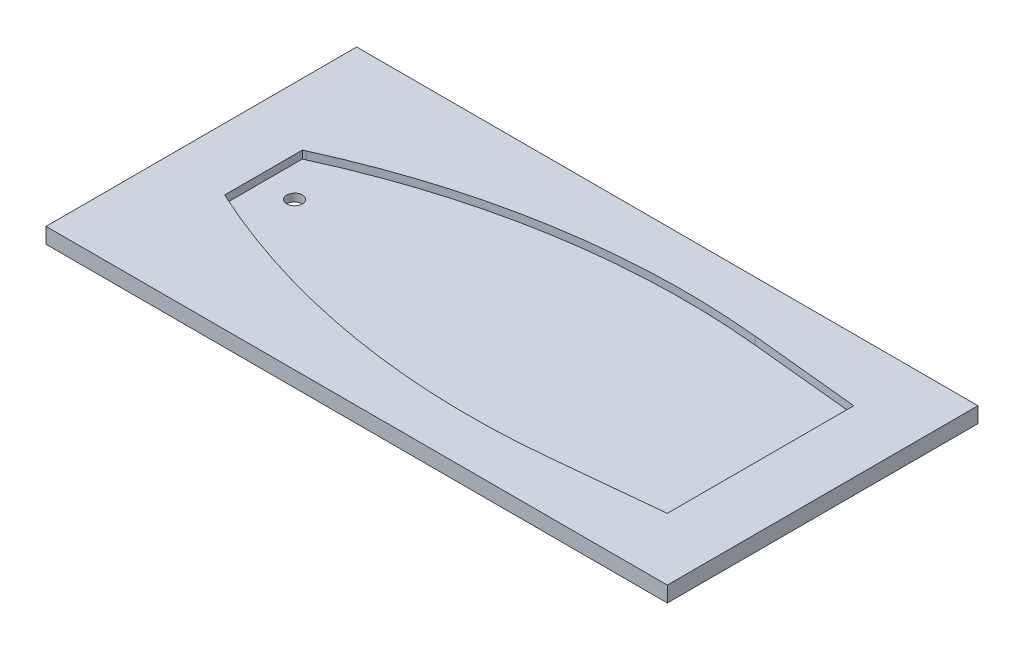
from build123d import *

# Parameters (mm, degrees)
SKETCH1_W           = 254
SKETCH1_H           = 127
BOSS_EXTRUDE1_DEPTH = 6.35
SKETCH2_R           = 3.175
CUT_EXTRUDE1_DEPTH  = 6.35
CUT_EXTRUDE3_DEPTH  = 3.175
FILLET2_R           = 304.8


with BuildPart() as part:
    # Sketch1 → Boss-Extrude1 (new body)
    with BuildSketch(Plane(origin=(0, 0, 0), x_dir=(1, 0, 0), z_dir=(0, 1, 0))):
        Rectangle(SKETCH1_W, SKETCH1_H)
    extrude(amount=BOSS_EXTRUDE1_DEPTH)

    # Sketch2 → Cut-Extrude1 (cut)
    with BuildSketch(Plane(origin=(0, 6.35, 0), x_dir=(1, 0, 0), z_dir=(0, 1, 0))):
        with Locations((-88.9, 0)):
            Circle(SKETCH2_R)
    extrude(amount=-CUT_EXTRUDE1_DEPTH, mode=Mode.SUBTRACT)

    # Sketch5 → Cut-Extrude3 (cut)
    with BuildSketch(Plane(origin=(0, 6.35, 0), x_dir=(1, 0, 0), z_dir=(0, 1, 0))):
        Polygon((-101.6, 15.875), (-101.6, -15.875), (-25.4, -50.8), (101.6, -38.1), (101.6, 38.1), (-25.4, 50.8), align=None)
    extrude(amount=-CUT_EXTRUDE3_DEPTH, mode=Mode.SUBTRACT)

    # Fillet2
    fillet2_edges = [part.edges().sort_by_distance(p)[0] for p in [
        (-25.4, 4.7625, 50.8),
        (-25.4, 4.7625, -50.8),
    ]]
    fillet(fillet2_edges, radius=FILLET2_R)


solid = part.part
